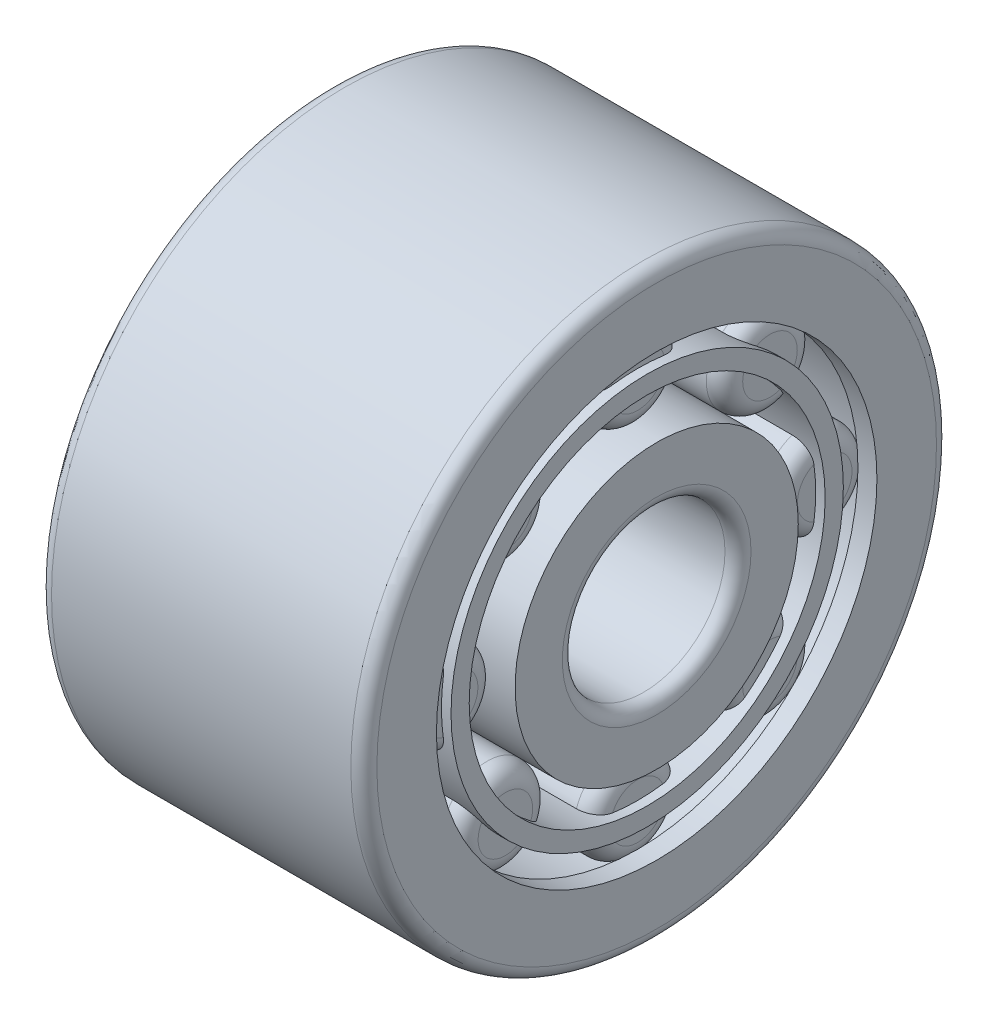
from build123d import *

# Parameters (mm, degrees)
CAGSPISKE_W           = 29.897916666
CAGSPISKE_H           = 1.775025
ROLLERSDETAILED_COUNT = 8
ROLLERSDETAILED_ANGLE = 315


with BuildPart() as part:
    # OutRacSke → OuterRace (revolve)
    with BuildSketch(Plane.XY):
        with BuildLine():
            Line((-14.022916667, 22.6933125), (-14.022916667, 21.4933125))
            Line((-14.022916667, 21.4933125), (-15.875, 21.4933125))
            Line((-15.875, 21.4933125), (-15.875, 27.305))
            ThreePointArc((-15.875, 27.305), (-15.503025612, 28.203025612), (-14.605, 28.575))
            Line((-14.605, 28.575), (14.605, 28.575))
            ThreePointArc((14.605, 28.575), (15.503025612, 28.203025612), (15.875, 27.305))
            Line((15.875, 27.305), (15.875, 21.4933125))
            Line((15.875, 21.4933125), (14.022916667, 21.4933125))
            Line((14.022916667, 21.4933125), (14.022916667, 22.6933125))
            Line((14.022916667, 22.6933125), (-14.022916667, 22.6933125))
        make_face()
    revolve(axis=Axis((-7.9375, 0, 0), (1, 0, 0)))

    # RolDetSke → RollerDetailed (revolve)
    with BuildSketch(Plane.XY):
        with BuildLine():
            Line((-14.022916667, 20.9187875), (-14.022916667, 18.25625))
            Line((-14.022916667, 18.25625), (14.022916667, 18.25625))
            Line((14.022916667, 18.25625), (14.022916667, 20.9187875))
            ThreePointArc((14.022916667, 20.9187875), (13.503023881, 22.173919714), (12.247891667, 22.6938125))
            Line((12.247891667, 22.6938125), (-12.247891667, 22.6938125))
            ThreePointArc((-12.247891667, 22.6938125), (-13.503023881, 22.173919714), (-14.022916667, 20.9187875))
        make_face()
    rollerdetailed = revolve(axis=Axis((-28.575, 18.25625, 0), (1, 0, 0)))

    # InsRacSke → InnerRace (revolve)
    with BuildSketch(Plane.XY):
        with BuildLine():
            Line((-15.875, 13.8191875), (-15.875, 9.2075))
            ThreePointArc((-15.875, 9.2075), (-15.503025612, 8.309474388), (-14.605, 7.9375))
            Line((-14.605, 7.9375), (14.605, 7.9375))
            ThreePointArc((14.605, 7.9375), (15.503025612, 8.309474388), (15.875, 9.2075))
            Line((15.875, 9.2075), (15.875, 13.8191875))
            Line((15.875, 13.8191875), (-15.875, 13.8191875))
        make_face()
    revolve(axis=Axis((-7.9375, 0, 0), (1, 0, 0)))

    # CagSpiSke → CageSpine (revolve)
    with BuildSketch(Plane.XY):
        with Locations((0, 18.25625)):
            Rectangle(CAGSPISKE_W, CAGSPISKE_H)
    revolve(axis=Axis((-17.159454586, 0, 0), (1, 0, 0)))

    # RollersDetailed: RollerDetailed ×8 about axis
    rollersdetailed_axis = Axis((-50, 0, 0), (1, 0, 0))
    for i in range(1, ROLLERSDETAILED_COUNT):
        add(rollerdetailed.rotate(rollersdetailed_axis, i * ROLLERSDETAILED_ANGLE / (ROLLERSDETAILED_COUNT - 1)))


solid = part.part
